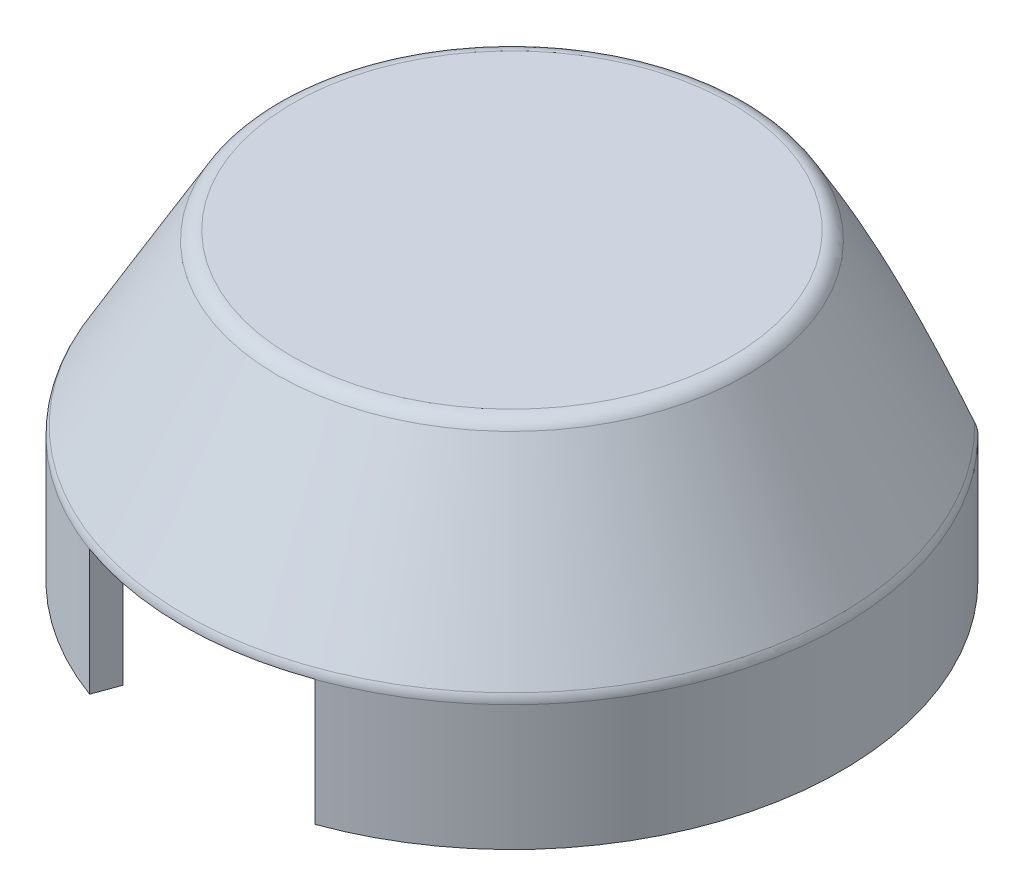
from build123d import *

# Parameters (mm, degrees)
ESQUISSE1_R                                   = 38
BOSS_EXTRU_1_DEPTH                            = 15
ESQUISSE4_R                                   = 35
ENL_V_MAT_EXTRU_1_DEPTH                       = 14.5
ESQUISSE9_R                                   = 38
BOSS_EXTRU_2_DEPTH                            = 20
BOSS_EXTRU_2_TAPER                            = 30
CONG_1_R                                      = 2
ESQUISSE7_W                                   = 6
ESQUISSE7_H                                   = 14.5
ENL_VEMENT_DE_MATI_RE_R_VOLUTION1_ANGLE       = 20
ENL_VEMENT_DE_MATI_RE_R_VOLUTION1_OTHER_ANGLE = 20
ENL_V_MAT_EXTRU_3_DEPTH                       = 65.132675714
ENL_V_MAT_EXTRU_3_DEPTH_BACK                  = 65.132675714
ESQUISSE10_W                                  = 90
ESQUISSE10_H                                  = 30
BOSS_EXTRU_3_REACH                            = 66.132
ESQUISSE14_W                                  = 3
ESQUISSE14_H                                  = 1.5
R_VOLUTION1_ANGLE                             = 4
ENL_V_MAT_EXTRU_4_DEPTH                       = 9


# Read off the part's stored shape, not the designer's step: Coque1
with BuildPart() as part:
    # Esquisse1 → Boss.-Extru.1 (new body)
    with BuildSketch(Plane(origin=(0, 0, 0), x_dir=(1, 0, 0), z_dir=(0, 1, 0))):
        with Locations(Location((0, 0, 0), (0, 0, 270))):
            Circle(ESQUISSE1_R)
    extrude(amount=BOSS_EXTRU_1_DEPTH)

    # Esquisse4 → Enlèv. mat.-Extru.1 (cut)
    with BuildSketch(Plane.XZ):
        with Locations(Location((0, 0, 0), (0, 0, 270))):
            Circle(ESQUISSE4_R)
    extrude(amount=-ENL_V_MAT_EXTRU_1_DEPTH, mode=Mode.SUBTRACT)

    # Esquisse9 → Boss.-Extru.2 (add)
    with BuildSketch(Plane(origin=(0, 15, 0), x_dir=(1, 0, 0), z_dir=(0, 1, 0))):
        with Locations(Location((0, 0, 0), (0, 0, 270))):
            Circle(ESQUISSE9_R)
    extrude(amount=BOSS_EXTRU_2_DEPTH, taper=BOSS_EXTRU_2_TAPER)

    # Congé1
    cong_1_edges = [part.edges().sort_by_distance(p)[0] for p in [
        (0, 35, -26.452994616),
        (0, 15, -38),
    ]]
    fillet(cong_1_edges, radius=CONG_1_R)

    # Esquisse7 → Enlèvement de matière-Révolution1 (revolve, cut)
    with BuildSketch(Plane(origin=(0, 0, 0), x_dir=(0, 0, -1), z_dir=(1, 0, 0))):
        with Locations((-35, 7.25)):
            Rectangle(ESQUISSE7_W, ESQUISSE7_H)
    revolve(axis=Axis((0, 0, 0), (0, 1, 0)), revolution_arc=ENL_VEMENT_DE_MATI_RE_R_VOLUTION1_ANGLE, mode=Mode.SUBTRACT)

    # Esquisse7 → Enlèvement de matière-Révolution1 other (revolve, cut)
    with BuildSketch(Plane(origin=(0, 0, 0), x_dir=(0, 0, -1), z_dir=(1, 0, 0))):
        with Locations((-35, 7.25)):
            Rectangle(ESQUISSE7_W, ESQUISSE7_H)
    revolve(axis=Axis((0, 0, 0), (0, -1, 0)), revolution_arc=ENL_VEMENT_DE_MATI_RE_R_VOLUTION1_OTHER_ANGLE, mode=Mode.SUBTRACT)

    # Coque1 outline → Coque1 (revolve, cut)
    with BuildSketch(Plane.XY):
        Polygon((34.824573519, 14.5), (24.720943809, 32), (0, 32), (0, 14.5), align=None)
    revolve(axis=Axis((0, 0, 0), (0, 1, 0)), mode=Mode.SUBTRACT)

    # Esquisse10 → Enlèv. mat.-Extru.3 (cut, two sides: drawn at the far end of the back side and taken through both)
    with BuildSketch(Plane(origin=(0, 0, 0), x_dir=(1, 0, 0), z_dir=(0, 1, 0)).offset(-ENL_V_MAT_EXTRU_3_DEPTH_BACK)):
        with Locations((0, 42)):
            Rectangle(ESQUISSE10_W, ESQUISSE10_H)
    extrude(amount=ENL_V_MAT_EXTRU_3_DEPTH + ENL_V_MAT_EXTRU_3_DEPTH_BACK, mode=Mode.SUBTRACT)

    # Esquisse13 → Boss.-Extru.3 (add, up to next)
    with BuildSketch(Plane(origin=(0, 0, 0), x_dir=(1, 0, 0), z_dir=(0, 1, 0)), mode=Mode.PRIVATE) as boss_extru_3_sk1:
        with BuildLine():
            Line((22.271057451, 27), (-22.271057451, 27))
            ThreePointArc((-22.271057451, 27), (-23.920345348, 25.55028529), (-25.475478406, 24))
            Line((-25.475478406, 24), (25.475478406, 24))
            ThreePointArc((25.475478406, 24), (23.920345348, 25.55028529), (22.271057451, 27))
        make_face()
    boss_extru_3_tool1 = extrude(boss_extru_3_sk1.sketch, amount=BOSS_EXTRU_3_REACH, mode=Mode.PRIVATE) - part.part
    add(boss_extru_3_tool1.solids().sort_by_distance((0, 0, -25.466594))[0])

    # Esquisse14 → Révolution1 (revolve)
    with BuildSketch(Plane(origin=(0, 0, 0), x_dir=(0, -1, 0), z_dir=(-0.500000000000001, 0, 0.866025403784438))):
        with Locations((-1.5, 34.25)):
            Rectangle(ESQUISSE14_W, ESQUISSE14_H)
        with Locations((-1.5, -34.25)):
            Rectangle(ESQUISSE14_W, ESQUISSE14_H)
    revolve(axis=Axis((0, 0, 0), (0, 1, 0)), revolution_arc=R_VOLUTION1_ANGLE)

    # Esquisse15 → Enlèv. mat.-Extru.4 (cut)
    with BuildSketch(Plane(origin=(0, 0, 0), x_dir=(1, 0, 0), z_dir=(0, 1, 0))):
        with BuildLine():
            Line((28.722813233, 20), (-28.722813233, 20))
            ThreePointArc((-28.722813233, 20), (0, 35), (28.722813233, 20))
        make_face()
    extrude(amount=ENL_V_MAT_EXTRU_4_DEPTH, mode=Mode.SUBTRACT)


solid = part.part
